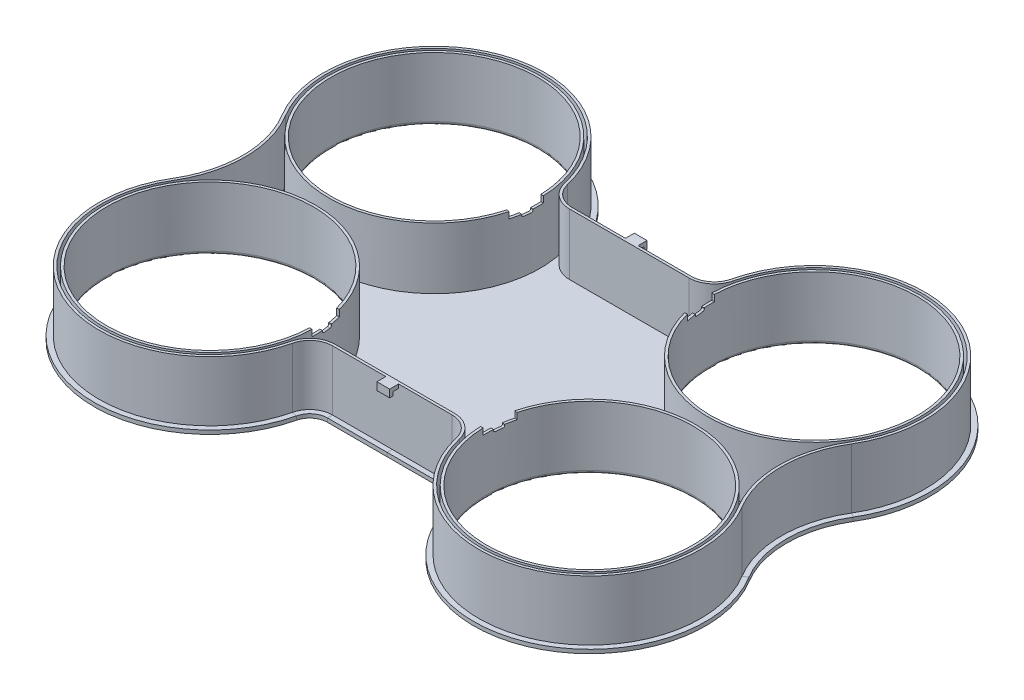
from build123d import *

# Parameters (mm, degrees)
SKETCH1_R                                    = 40.5
BOSS_EXTRUDE1_DEPTH                          = 25
SHELL1_T                                     = -1
FILLET1_R                                    = 1.5
SKETCH2_W                                    = 2
SKETCH2_H                                    = 1.5
ARMCUTSMAIN_START                            = -2.5
ARMCUTSMAIN_DEPTH                            = 2.5
ARMCUTDETAIL_DEPTH                           = 5
ARMCUTDUPES_AT_THE_SECOND_PLANE_COPY_1_DEPTH = 5
HOOKS_DEPTH                                  = 2.5


with BuildPart() as part:
    # Sketch1 → Boss-Extrude1 (new body)
    with BuildSketch(Plane(origin=(0, 0, 0), x_dir=(1, 0, 0), z_dir=(0, 1, 0))):
        with BuildLine():
            Line((-23.389824888, 47), (23.389824888, 47))
            ThreePointArc((23.389824888, 47), (28.979355918, 48.946125685), (32.151569193, 53.942857143))
            ThreePointArc((32.151569193, 53.942857143), (90.931692418, 84.277158344), (111.718349922, 21.482352941))
            ThreePointArc((111.718349922, 21.482352941), (105.725511342, 0), (111.718349922, -21.482352941))
            ThreePointArc((111.718349922, -21.482352941), (90.931692418, -84.277158344), (32.151569193, -53.942857143))
            ThreePointArc((32.151569193, -53.942857143), (28.979355918, -48.946125685), (23.389824888, -47))
            Line((23.389824888, -47), (-23.389824888, -47))
            ThreePointArc((-23.389824888, -47), (-28.979355918, -48.946125685), (-32.151569193, -53.942857143))
            ThreePointArc((-32.151569193, -53.942857143), (-90.931692418, -84.277158344), (-111.718349922, -21.482352941))
            ThreePointArc((-111.718349922, -21.482352941), (-105.725511342, 0), (-111.718349922, 21.482352941))
            ThreePointArc((-111.718349922, 21.482352941), (-90.931692418, 84.277158344), (-32.151569193, 53.942857143))
            ThreePointArc((-32.151569193, 53.942857143), (-28.979355918, 48.946125685), (-23.389824888, 47))
        make_face()
        with Locations((74.5, 44)):
            Circle(SKETCH1_R, mode=Mode.SUBTRACT)
        with Locations((74.5, -44)):
            Circle(SKETCH1_R, mode=Mode.SUBTRACT)
        with Locations((-74.5, -44)):
            Circle(SKETCH1_R, mode=Mode.SUBTRACT)
        with Locations((-74.5, 44)):
            Circle(SKETCH1_R, mode=Mode.SUBTRACT)
    extrude(amount=BOSS_EXTRUDE1_DEPTH)

    # Shell1
    shell1_openings = [part.faces().sort_by_distance(p)[0] for p in [
        (0, 25, 0),
    ]]
    offset(amount=SHELL1_T, openings=shell1_openings, kind=Kind.INTERSECTION)

    # Fillet1
    fillet1_edges = [part.edges().sort_by_distance(p)[0] for p in [
        (34, 0, -44),
        (34, 0, 44),
        (-115, 0, 44),
        (-115, 0, -44),
    ]]
    fillet(fillet1_edges, radius=FILLET1_R)

    # Lip: sweep along a path in Sketch1<2>
    with BuildLine(Plane(origin=(0, 0, 0), x_dir=(1, 0, 0), z_dir=(0, 1, 0))) as lip_path:
        Line((-23.389824888, 47), (23.389824888, 47))
        ThreePointArc((23.389824888, 47), (28.979355918, 48.946125685), (32.151569193, 53.942857143))
        ThreePointArc((32.151569193, 53.942857143), (90.931692418, 84.277158344), (111.718349922, 21.482352941))
        ThreePointArc((111.718349922, 21.482352941), (105.725511342, 0), (111.718349922, -21.482352941))
        ThreePointArc((111.718349922, -21.482352941), (90.931692418, -84.277158344), (32.151569193, -53.942857143))
        ThreePointArc((32.151569193, -53.942857143), (28.979355918, -48.946125685), (23.389824888, -47))
        Line((23.389824888, -47), (-23.389824888, -47))
        ThreePointArc((-23.389824888, -47), (-28.979355918, -48.946125685), (-32.151569193, -53.942857143))
        ThreePointArc((-32.151569193, -53.942857143), (-90.931692418, -84.277158344), (-111.718349922, -21.482352941))
        ThreePointArc((-111.718349922, -21.482352941), (-105.725511342, 0), (-111.718349922, 21.482352941))
        ThreePointArc((-111.718349922, 21.482352941), (-90.931692418, 84.277158344), (-32.151569193, 53.942857143))
        ThreePointArc((-32.151569193, 53.942857143), (-28.979355918, 48.946125685), (-23.389824888, 47))
    # Sketch2 → Lip (sweep)
    with BuildSketch(Plane(origin=(0, 0, 0), x_dir=(0, 0, -1), z_dir=(1, 0, 0))):
        with Locations((-48, 0.75)):
            Rectangle(SKETCH2_W, SKETCH2_H)
    sweep(path=lip_path.line)

    # Sketch3 → ArmCutsMain (cut)
    with BuildSketch(Plane(origin=(0, 25, 0), x_dir=(1, 0, 0), z_dir=(0, 1, 0)).offset(ARMCUTSMAIN_START)):
        with BuildLine():
            Line((33.02362118, -45.4), (74.5, -44))
            Line((74.5, -44), (34.426621288, -33.212307077))
            ThreePointArc((34.426621288, -33.212307077), (33.272270217, -39.25402308), (33.02362118, -45.4))
        make_face()
        with BuildLine():
            Line((-34.426621288, -33.212307077), (-74.5, -44))
            Line((-74.5, -44), (-33.02362118, -45.4))
            ThreePointArc((-33.02362118, -45.4), (-33.272270217, -39.25402308), (-34.426621288, -33.212307077))
        make_face()
        with BuildLine():
            Line((-33.02362118, 45.4), (-74.5, 44))
            Line((-74.5, 44), (-34.426621288, 33.212307077))
            ThreePointArc((-34.426621288, 33.212307077), (-33.272270217, 39.25402308), (-33.02362118, 45.4))
        make_face()
        with BuildLine():
            Line((34.426621288, 33.212307077), (74.5, 44))
            Line((74.5, 44), (33.02362118, 45.4))
            ThreePointArc((33.02362118, 45.4), (33.272270217, 39.25402308), (34.426621288, 33.212307077))
        make_face()
    extrude(amount=ARMCUTSMAIN_DEPTH, mode=Mode.SUBTRACT)

    # Sketch6 → ArmCutDetail (cut)
    with BuildSketch(Plane(origin=(38.732173012, 0, 4.45869807), x_dir=(-0.11436088964892266, 0, 0.9934392718826385), z_dir=(-0.9934392718826385, 0, -0.11436088964892266))):
        with BuildLine():
            Line((37.205160533, 22.5), (33.205160533, 22.5))
            Line((33.205160533, 22.5), (33.205160533, 22.1))
            ThreePointArc((33.205160533, 22.1), (33.380896465, 21.675735931), (33.805160533, 21.5))
            Line((33.805160533, 21.5), (36.605160533, 21.5))
            ThreePointArc((36.605160533, 21.5), (37.029424602, 21.675735931), (37.205160533, 22.1))
            Line((37.205160533, 22.1), (37.205160533, 22.5))
        make_face()
    armcutdetail = extrude(amount=ARMCUTDETAIL_DEPTH, mode=Mode.SUBTRACT)

    # ArmCutDupes: ArmCutDetail across plane
    add(armcutdetail.mirror(Plane(origin=(0, 0, 0), x_dir=(0, 0, 1), z_dir=(1, 0, 0))), mode=Mode.SUBTRACT)

    # ArmCutDupes at the second plane: ArmCutDetail across plane
    add(armcutdetail.mirror(Plane.XY), mode=Mode.SUBTRACT)

    # ArmCutDupes at the second plane copy 1 s → ArmCutDupes at the second plane copy 1 (cut)
    with BuildSketch(Plane(origin=(-38.732173012, 0, -4.45869807), x_dir=(0.11436088964892266, 0, -0.9934392718826385), z_dir=(0.9934392718826385, 0, 0.11436088964892266))):
        with BuildLine():
            Line((37.205160533, 22.5), (33.205160533, 22.5))
            Line((33.205160533, 22.5), (33.205160533, 22.1))
            ThreePointArc((33.205160533, 22.1), (33.380896465, 21.675735931), (33.805160533, 21.5))
            Line((33.805160533, 21.5), (36.605160533, 21.5))
            ThreePointArc((36.605160533, 21.5), (37.029424602, 21.675735931), (37.205160533, 22.1))
            Line((37.205160533, 22.1), (37.205160533, 22.5))
        make_face()
    extrude(amount=ARMCUTDUPES_AT_THE_SECOND_PLANE_COPY_1_DEPTH, mode=Mode.SUBTRACT)

    # Sketch7 → Hooks (add, symmetric)
    with BuildSketch(Plane(origin=(0, 0, 0), x_dir=(0, 0, -1), z_dir=(1, 0, 0))):
        Polygon((47, 25), (50.5, 25), (50.5, 22), (49.25, 22), (49.25, 23.5), (47, 23.5), align=None)
        Polygon((-47, 23.5), (-47, 25), (-50.5, 25), (-50.5, 22), (-49.25, 22), (-49.25, 23.5), align=None)
    extrude(amount=HOOKS_DEPTH, both=True)


solid = part.part
